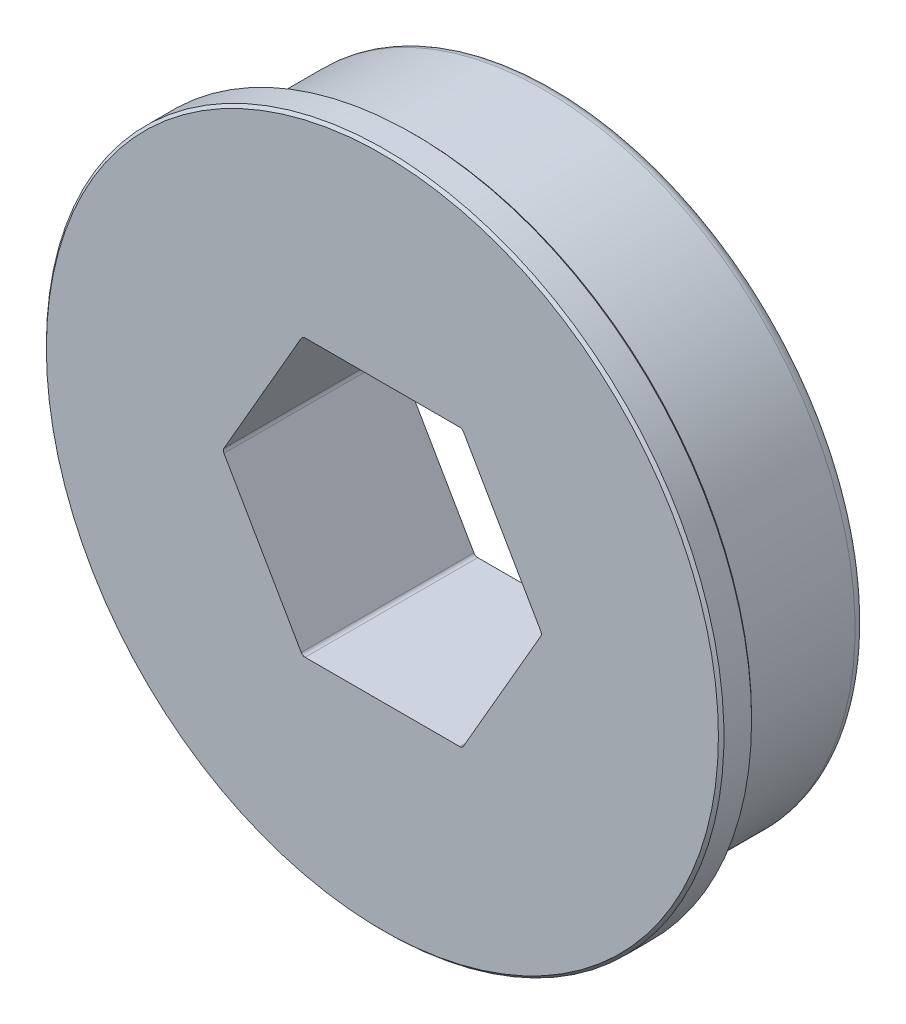
from build123d import *

# Parameters (mm, degrees)
SKETCH1_R           = 15.5575
BOSS_EXTRUDE1_DEPTH = 1.524
SKETCH2_R           = 13.97
BOSS_EXTRUDE2_DEPTH = 0.508
SKETCH3_R           = 14.2875
BOSS_EXTRUDE3_DEPTH = 5.89534
CUT_EXTRUDE1_DEPTH  = 24.386199605
CHAMFER1_SIZE       = 0.127
CHAMFER2_SIZE       = 0.127
FILLET1_R           = 0.2032
FILLET2_R           = 0.508


with BuildPart() as part:
    # Sketch1 → Boss-Extrude1 (new body)
    with BuildSketch(Plane(origin=(0, 0, 6.40334), x_dir=(-1, 0, 0), z_dir=(0, 0, -1))):
        Circle(SKETCH1_R)
    extrude(amount=-BOSS_EXTRUDE1_DEPTH)

    # Sketch2 → Boss-Extrude2 (add)
    with BuildSketch(Plane(origin=(0, 0, 6.40334), x_dir=(-1, 0, 0), z_dir=(0, 0, -1))):
        Circle(SKETCH2_R)
    extrude(amount=BOSS_EXTRUDE2_DEPTH)

    # Sketch3 → Boss-Extrude3 (add)
    with BuildSketch(Plane.XY.offset(5.89534)):
        Circle(SKETCH3_R)
    extrude(amount=-BOSS_EXTRUDE3_DEPTH)

    # Sketch4 → Cut-Extrude1 (cut, through all)
    with BuildSketch(Plane.XY.offset(7.92734)):
        Polygon((7.332348419, 0), (3.666174209, 6.35), (-3.666174209, 6.35), (-7.332348419, 0), (-3.666174209, -6.35), (3.666174209, -6.35), align=None)
    extrude(amount=-CUT_EXTRUDE1_DEPTH, mode=Mode.SUBTRACT)

    # Chamfer1
    chamfer1_edges = [part.edges().sort_by_distance(p)[0] for p in [
        (15.5575, 0, 7.92734),
    ]]
    chamfer(chamfer1_edges, length=CHAMFER1_SIZE)

    # Chamfer2
    chamfer2_edges = [part.edges().sort_by_distance(p)[0] for p in [
        (15.5575, 0, 6.40334),
    ]]
    chamfer(chamfer2_edges, length=CHAMFER2_SIZE)

    # Fillet1
    fillet1_edges = [part.edges().sort_by_distance(p)[0] for p in [
        (7.332348419, 0, 3.96367),
        (3.666174209, 6.35, 3.96367),
        (-3.666174209, -6.35, 3.96367),
        (3.666174209, -6.35, 3.96367),
        (-7.332348419, 0, 3.96367),
        (-3.666174209, 6.35, 3.96367),
    ]]
    fillet(fillet1_edges, radius=FILLET1_R)

    # Fillet2
    fillet2_edges = [part.edges().sort_by_distance(p)[0] for p in [
        (-14.2875, 0, 0),
    ]]
    fillet(fillet2_edges, radius=FILLET2_R)


solid = part.part
